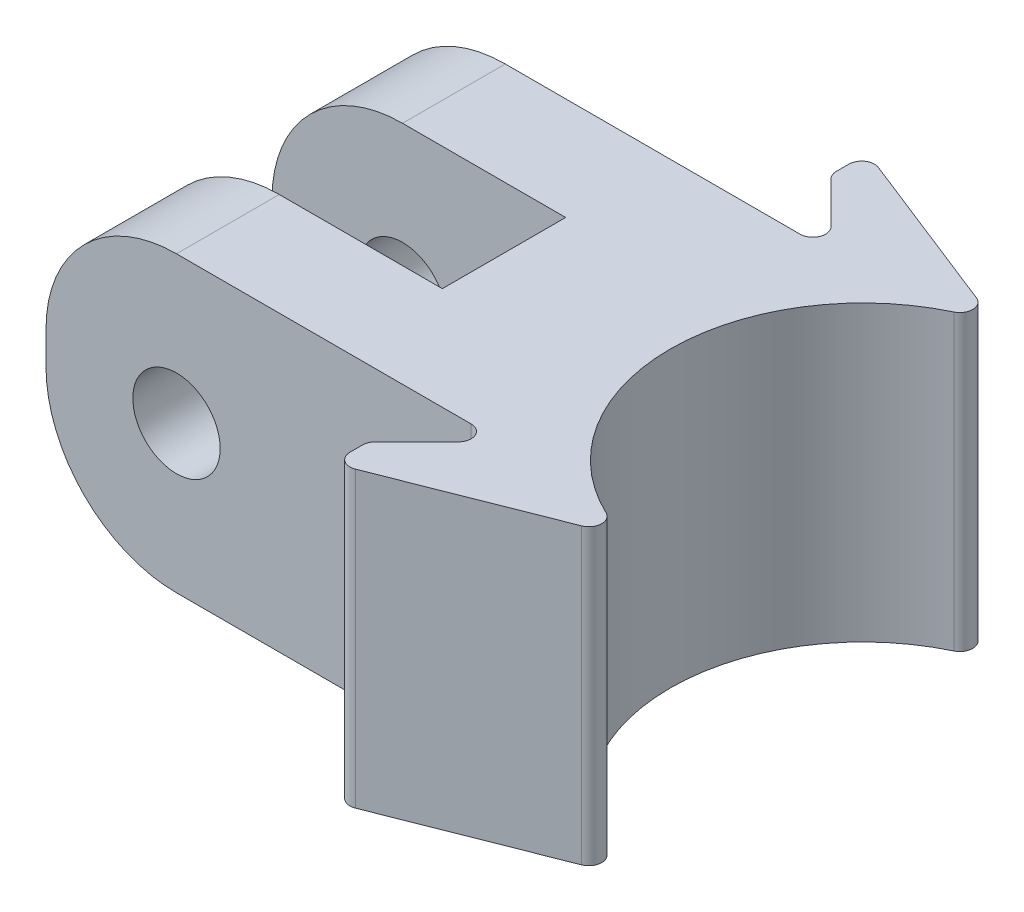
from build123d import *

# Parameters (mm, degrees)
BOSS_EXTRUDE1_DEPTH     = 11.43
FILLET1_R               = 5.08
M3_CLEARANCE_HOLE1_D    = 3.4
CUT_EXTRUDE1_DEPTH      = 21.853868648
CUT_EXTRUDE1_DEPTH_BACK = 21.853868648
SKETCH5_R               = 7.5
FILLET2_R               = 0.5


with BuildPart() as part:
    # Sketch1 → Boss-Extrude1 (new body)
    with BuildSketch(Plane(origin=(0, 0, 0), x_dir=(1, 0, 0), z_dir=(0, 1, 0))):
        Polygon((-11.43, 2.4), (0, 2.4), (0, -2.4), (-11.43, -2.4), (-11.43, -6.4), (6.329871458, -6.4), (3.714801747, -9.015069712), (3.714801747, -10.444043162), (13.97, -6.4), (13.97, 6.4), (3.714801747, 10.444043162), (3.714801747, 9.015069712), (6.329871458, 6.4), (-11.43, 6.4), align=None)
    extrude(amount=BOSS_EXTRUDE1_DEPTH)

    # Fillet1
    fillet1_edges = [part.edges().sort_by_distance(p)[0] for p in [
        (-11.43, 0, 4.4),
        (-11.43, 0, -4.4),
        (-11.43, 11.43, 4.4),
        (-11.43, 11.43, -4.4),
    ]]
    fillet(fillet1_edges, radius=FILLET1_R)

    # M3 Clearance Hole1 (through all)
    with Locations(Plane.XY.offset(6.4)):
        with Locations((-6.35, 5.715)):
            Hole(M3_CLEARANCE_HOLE1_D / 2)

    # Sketch5 → Cut-Extrude1 (cut, two sides: drawn at the far end of the back side and taken through both)
    with BuildSketch(Plane(origin=(0, 11.43, 0), x_dir=(1, 0, 0), z_dir=(0, 1, 0)).offset(-CUT_EXTRUDE1_DEPTH_BACK)):
        with Locations((13.97, 0)):
            Circle(SKETCH5_R)
    extrude(amount=CUT_EXTRUDE1_DEPTH + CUT_EXTRUDE1_DEPTH_BACK, mode=Mode.SUBTRACT)

    # Fillet2
    fillet2_edges = [part.edges().sort_by_distance(p)[0] for p in [
        (3.714801747, 5.715, 10.444043162),
        (3.714801747, 5.715, 9.015069712),
        (6.329871458, 5.715, 6.4),
        (6.329871458, 5.715, -6.4),
        (3.714801747, 5.715, -9.015069712),
        (3.714801747, 5.715, -10.444043162),
        (11.911170406, 5.715, 7.211880525),
        (11.911170406, 5.715, -7.211880525),
    ]]
    fillet(fillet2_edges, radius=FILLET2_R)


solid = part.part
